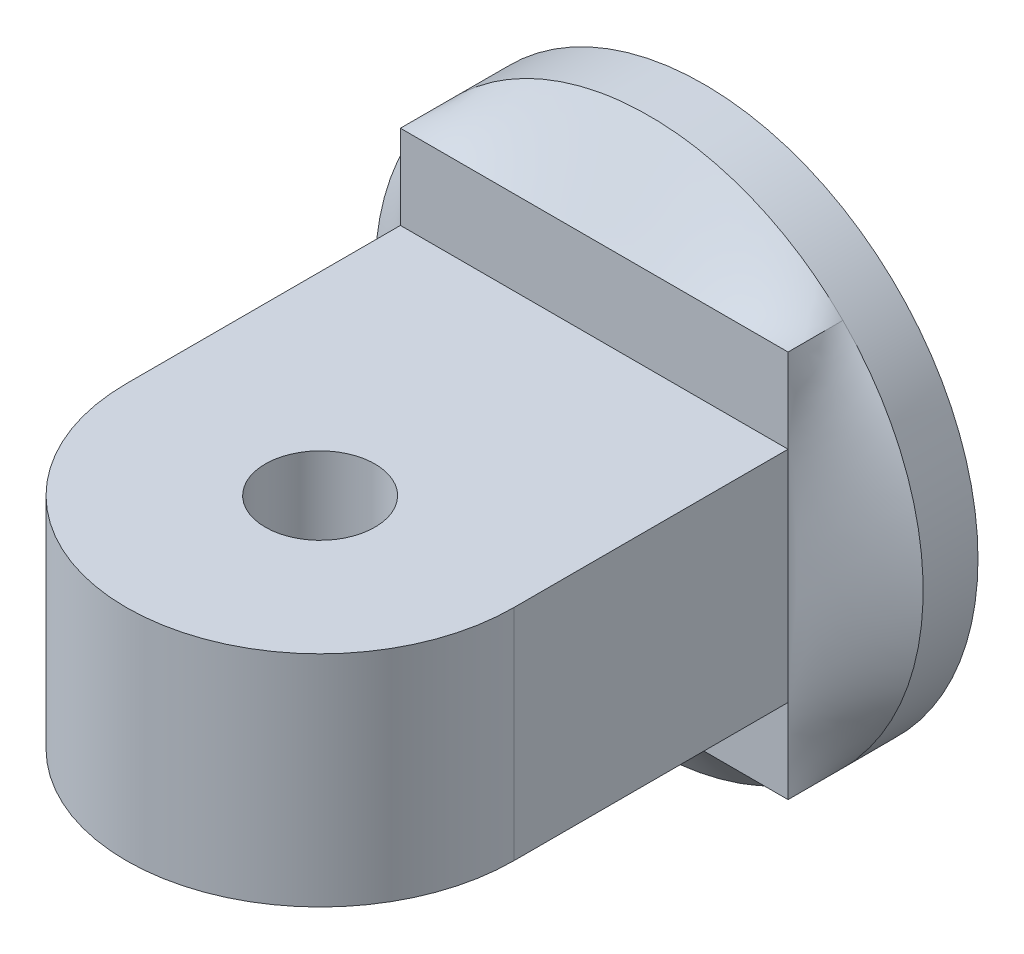
from build123d import *

# Parameters (mm, degrees)
SKETCH1_R                       = 50
BOSS_EXTRUDE1_DEPTH             = 10
SKETCH3_W                       = 70.710678118
SKETCH3_H                       = 40
BOSS_EXTRUDE2_DEPTH             = 50
BOSS_EXTRUDE3_REACH             = 101.499
BOSS_EXTRUDE3_DIRECTION_2_REACH = 101.499
SKETCH5_R                       = 10
CUT_EXTRUDE1_DEPTH              = 40


with BuildPart() as part:
    # Sketch1 → Boss-Extrude1 (new body)
    with BuildSketch(Plane.XY):
        Circle(SKETCH1_R)
    extrude(amount=BOSS_EXTRUDE1_DEPTH)

    # Loft1: read off the stored shape, not the designer's step
    # Loft1: loft between two sections, ruled curve by curve
    loft1_from = [
        Edge.make_bspline([(-35.355339059, -35.355339059, 10), (-33.272005726, -37.438672393, 10), (-30.925559549, -39.414711482, 10), (-25.737899021, -42.982208745, 10), (-22.896419748, -44.572511855, 10), (-16.821315002, -47.201675945, 10), (-13.588165153, -48.239248246, 10), (-6.902782293, -49.63884467, 10), (-3.451779686, -50, 10), (3.451779686, -50, 10), (6.902782293, -49.63884467, 10), (13.588165153, -48.239248246, 10), (16.821315002, -47.201675945, 10), (22.896419748, -44.572511855, 10), (25.737899021, -42.982208745, 10), (30.925559549, -39.414711482, 10), (33.272005726, -37.438672393, 10), (35.355339059, -35.355339059, 10)], [0, 0, 0, 0, 0.125, 0.125, 0.25, 0.25, 0.375, 0.375, 0.5, 0.5, 0.625, 0.625, 0.75, 0.75, 0.875, 0.875, 1, 1, 1, 1], 3),
        Edge.make_bspline([(35.355339059, -35.355339059, 10), (37.438672393, -33.272005726, 10), (39.414711482, -30.925559549, 10), (42.982208745, -25.737899021, 10), (44.572511855, -22.896419748, 10), (47.201675945, -16.821315002, 10), (48.239248246, -13.588165153, 10), (49.63884467, -6.902782293, 10), (50, -3.451779686, 10), (50, 3.451779686, 10), (49.63884467, 6.902782293, 10), (48.239248246, 13.588165153, 10), (47.201675945, 16.821315002, 10), (44.572511855, 22.896419748, 10), (42.982208745, 25.737899021, 10), (39.414711482, 30.925559549, 10), (37.438672393, 33.272005726, 10), (35.355339059, 35.355339059, 10)], [0, 0, 0, 0, 0.125, 0.125, 0.25, 0.25, 0.375, 0.375, 0.5, 0.5, 0.625, 0.625, 0.75, 0.75, 0.875, 0.875, 1, 1, 1, 1], 3),
        Edge.make_bspline([(-35.355339059, 35.355339059, 10), (-37.438672393, 33.272005726, 10), (-39.414711482, 30.925559549, 10), (-42.982208745, 25.737899021, 10), (-44.572511855, 22.896419748, 10), (-47.201675945, 16.821315002, 10), (-48.239248246, 13.588165153, 10), (-49.63884467, 6.902782293, 10), (-50, 3.451779686, 10), (-50, -3.451779686, 10), (-49.63884467, -6.902782293, 10), (-48.239248246, -13.588165153, 10), (-47.201675945, -16.821315002, 10), (-44.572511855, -22.896419748, 10), (-42.982208745, -25.737899021, 10), (-39.414711482, -30.925559549, 10), (-37.438672393, -33.272005726, 10), (-35.355339059, -35.355339059, 10)], [0, 0, 0, 0, 0.125, 0.125, 0.25, 0.25, 0.375, 0.375, 0.5, 0.5, 0.625, 0.625, 0.75, 0.75, 0.875, 0.875, 1, 1, 1, 1], 3),
        Edge.make_bspline([(35.355339059, 35.355339059, 10), (33.272005726, 37.438672393, 10), (30.925559549, 39.414711482, 10), (25.737899021, 42.982208745, 10), (22.896419748, 44.572511855, 10), (16.821315002, 47.201675945, 10), (13.588165153, 48.239248246, 10), (6.902782293, 49.63884467, 10), (3.451779686, 50, 10), (-3.451779686, 50, 10), (-6.902782293, 49.63884467, 10), (-13.588165153, 48.239248246, 10), (-16.821315002, 47.201675945, 10), (-22.896419748, 44.572511855, 10), (-25.737899021, 42.982208745, 10), (-30.925559549, 39.414711482, 10), (-33.272005726, 37.438672393, 10), (-35.355339059, 35.355339059, 10)], [0, 0, 0, 0, 0.125, 0.125, 0.25, 0.25, 0.375, 0.375, 0.5, 0.5, 0.625, 0.625, 0.75, 0.75, 0.875, 0.875, 1, 1, 1, 1], 3),
    ]
    loft1_to = [
        Edge.make_bspline([(-35.355339059, -35.355339059, 20), (-32.409060804, -35.355339059, 20), (-29.462782549, -35.355339059, 20), (-23.57022604, -35.355339059, 20), (-20.623947785, -35.355339059, 20), (-14.731391275, -35.355339059, 20), (-11.78511302, -35.355339059, 20), (-5.89255651, -35.355339059, 20), (-2.946278255, -35.355339059, 20), (2.946278255, -35.355339059, 20), (5.89255651, -35.355339059, 20), (11.78511302, -35.355339059, 20), (14.731391275, -35.355339059, 20), (20.623947785, -35.355339059, 20), (23.57022604, -35.355339059, 20), (29.462782549, -35.355339059, 20), (32.409060804, -35.355339059, 20), (35.355339059, -35.355339059, 20)], [0, 0, 0, 0, 0.125, 0.125, 0.25, 0.25, 0.375, 0.375, 0.5, 0.5, 0.625, 0.625, 0.75, 0.75, 0.875, 0.875, 1, 1, 1, 1], 3),
        Edge.make_bspline([(35.355339059, -35.355339059, 20), (35.355339059, -32.409060804, 20), (35.355339059, -29.462782549, 20), (35.355339059, -23.57022604, 20), (35.355339059, -20.623947785, 20), (35.355339059, -14.731391275, 20), (35.355339059, -11.78511302, 20), (35.355339059, -5.89255651, 20), (35.355339059, -2.946278255, 20), (35.355339059, 2.946278255, 20), (35.355339059, 5.89255651, 20), (35.355339059, 11.78511302, 20), (35.355339059, 14.731391275, 20), (35.355339059, 20.623947785, 20), (35.355339059, 23.57022604, 20), (35.355339059, 29.462782549, 20), (35.355339059, 32.409060804, 20), (35.355339059, 35.355339059, 20)], [0, 0, 0, 0, 0.125, 0.125, 0.25, 0.25, 0.375, 0.375, 0.5, 0.5, 0.625, 0.625, 0.75, 0.75, 0.875, 0.875, 1, 1, 1, 1], 3),
        Edge.make_bspline([(-35.355339059, 35.355339059, 20), (-35.355339059, 32.409060804, 20), (-35.355339059, 29.462782549, 20), (-35.355339059, 23.57022604, 20), (-35.355339059, 20.623947785, 20), (-35.355339059, 14.731391275, 20), (-35.355339059, 11.78511302, 20), (-35.355339059, 5.89255651, 20), (-35.355339059, 2.946278255, 20), (-35.355339059, -2.946278255, 20), (-35.355339059, -5.89255651, 20), (-35.355339059, -11.78511302, 20), (-35.355339059, -14.731391275, 20), (-35.355339059, -20.623947785, 20), (-35.355339059, -23.57022604, 20), (-35.355339059, -29.462782549, 20), (-35.355339059, -32.409060804, 20), (-35.355339059, -35.355339059, 20)], [0, 0, 0, 0, 0.125, 0.125, 0.25, 0.25, 0.375, 0.375, 0.5, 0.5, 0.625, 0.625, 0.75, 0.75, 0.875, 0.875, 1, 1, 1, 1], 3),
        Edge.make_bspline([(35.355339059, 35.355339059, 20), (32.409060804, 35.355339059, 20), (29.462782549, 35.355339059, 20), (23.57022604, 35.355339059, 20), (20.623947785, 35.355339059, 20), (14.731391275, 35.355339059, 20), (11.78511302, 35.355339059, 20), (5.89255651, 35.355339059, 20), (2.946278255, 35.355339059, 20), (-2.946278255, 35.355339059, 20), (-5.89255651, 35.355339059, 20), (-11.78511302, 35.355339059, 20), (-14.731391275, 35.355339059, 20), (-20.623947785, 35.355339059, 20), (-23.57022604, 35.355339059, 20), (-29.462782549, 35.355339059, 20), (-32.409060804, 35.355339059, 20), (-35.355339059, 35.355339059, 20)], [0, 0, 0, 0, 0.125, 0.125, 0.25, 0.25, 0.375, 0.375, 0.5, 0.5, 0.625, 0.625, 0.75, 0.75, 0.875, 0.875, 1, 1, 1, 1], 3),
    ]
    loft1 = Solid(Shell([*[Face.make_surface_from_curves(loft1_from[k], loft1_to[k]) for k in range(4)], Face(Wire(loft1_from)), Face(Wire(loft1_to))]))
    add(loft1)

    # Sketch3 → Boss-Extrude2 (add)
    with BuildSketch(Plane.XY.offset(20)):
        Rectangle(SKETCH3_W, SKETCH3_H)
    extrude(amount=BOSS_EXTRUDE2_DEPTH)

    # Boss-Extrude3: up to this face of the body (flat: up to its plane)
    boss_extrude3_end = Plane(part.part.faces().sort_by_distance((0, 20, 45))[0])
    # Sketch4 → Boss-Extrude3 (add, up to the picked face)
    with BuildSketch(Plane(origin=(0, 0, 0), x_dir=(1, 0, 0), z_dir=(0, 1, 0)), mode=Mode.PRIVATE) as boss_extrude3_sk1:
        with BuildLine():
            Line((35.355339059, -70), (-35.355339059, -70))
            ThreePointArc((-35.355339059, -70), (0, -105.355339059), (35.355339059, -70))
        make_face()
    boss_extrude3_tool1 = split(extrude(boss_extrude3_sk1.sketch, amount=BOSS_EXTRUDE3_REACH, mode=Mode.PRIVATE), bisect_by=boss_extrude3_end, keep=Keep.BOTH, mode=Mode.PRIVATE)
    add(boss_extrude3_tool1.solids().sort_by(Axis((0, 0, 85.005272), (0, 1, 0)))[0])

    # Boss-Extrude3 direction 2: up to this face of the body (flat: up to its plane)
    boss_extrude3_direction_2_end = Plane(part.part.faces().sort_by_distance((0, -20, 45))[0])
    # Sketch4 → Boss-Extrude3 direction 2 (add, up to the picked face)
    with BuildSketch(Plane(origin=(0, 0, 0), x_dir=(1, 0, 0), z_dir=(0, 1, 0)), mode=Mode.PRIVATE) as boss_extrude3_direction_2_sk1:
        with BuildLine():
            Line((35.355339059, -70), (-35.355339059, -70))
            ThreePointArc((-35.355339059, -70), (0, -105.355339059), (35.355339059, -70))
        make_face()
    boss_extrude3_direction_2_tool1 = split(extrude(boss_extrude3_direction_2_sk1.sketch, amount=-BOSS_EXTRUDE3_DIRECTION_2_REACH, mode=Mode.PRIVATE), bisect_by=boss_extrude3_direction_2_end, keep=Keep.BOTH, mode=Mode.PRIVATE)
    add(boss_extrude3_direction_2_tool1.solids().sort_by(Axis((0, 0, 85.005272), (0, -1, 0)))[0])

    # Sketch5 → Cut-Extrude1 (cut)
    with BuildSketch(Plane(origin=(0, 20, 0), x_dir=(1, 0, 0), z_dir=(0, 1, 0))):
        with Locations(Location((0, -70, 0), (0, 0, 270))):
            Circle(SKETCH5_R)
    extrude(amount=-CUT_EXTRUDE1_DEPTH, mode=Mode.SUBTRACT)


solid = part.part
